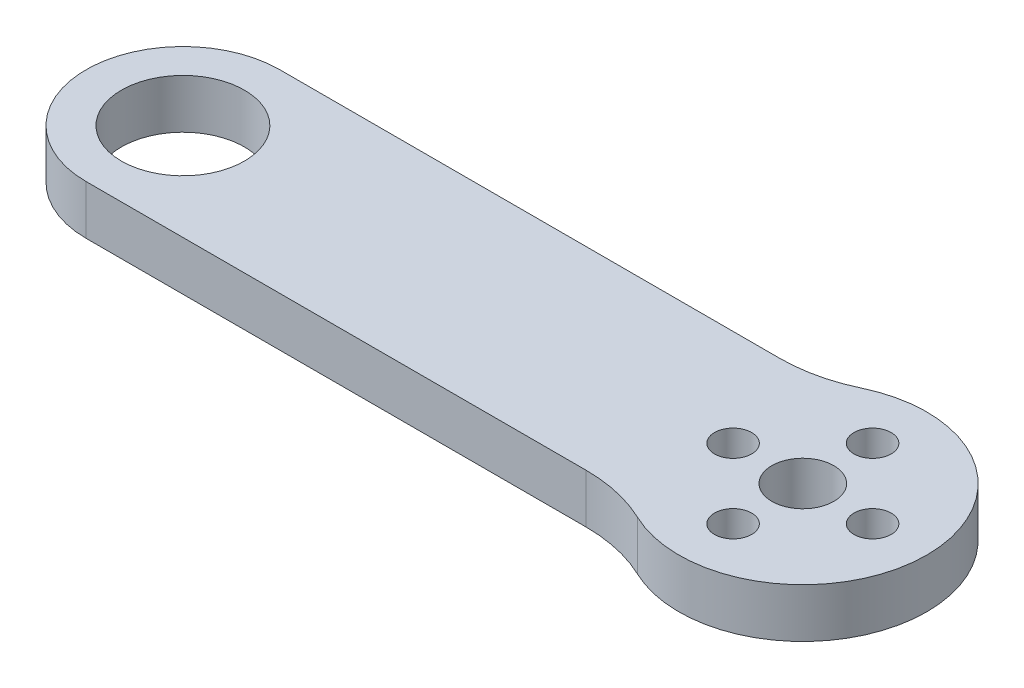
from build123d import *

# Parameters (mm, degrees)
SKETCH1_R            = 3.96875
SKETCH1_R_2          = 2
BOSS_EXTRUDE1_DEPTH  = 3.175
M2_CLEARANCE_HOLE1_D = 2.4


with BuildPart() as part:
    # Sketch1 → Boss-Extrude1 (new body)
    with BuildSketch(Plane(origin=(0, 0, 0), x_dir=(1, 0, 0), z_dir=(0, 1, 0))):
        with BuildLine():
            Line((-7.741931284, 6.25), (-40, 6.25))
            ThreePointArc((-40, 6.25), (-46.25, 0), (-40, -6.25))
            Line((-40, -6.25), (-7.741931284, -6.25))
            ThreePointArc((-7.741931284, -6.25), (-5.537138524, -6.496083408), (-3.440858348, -7.222222222))
            ThreePointArc((-3.440858348, -7.222222222), (8, 0), (-3.440858348, 7.222222222))
            ThreePointArc((-3.440858348, 7.222222222), (-5.537138524, 6.496083408), (-7.741931284, 6.25))
        make_face()
        with Locations((-40, 0)):
            Circle(SKETCH1_R, mode=Mode.SUBTRACT)
        Circle(SKETCH1_R_2, mode=Mode.SUBTRACT)
    extrude(amount=BOSS_EXTRUDE1_DEPTH)

    # M2 Clearance Hole1 (through all)
    with Locations(Plane(origin=(0, 3.175, 0), x_dir=(1, 0, 0), z_dir=(0, 1, 0))):
        with Locations((-4.5, 0), (0, 4.5), (4.5, 0), (0, -4.5)):
            Hole(M2_CLEARANCE_HOLE1_D / 2)


solid = part.part
